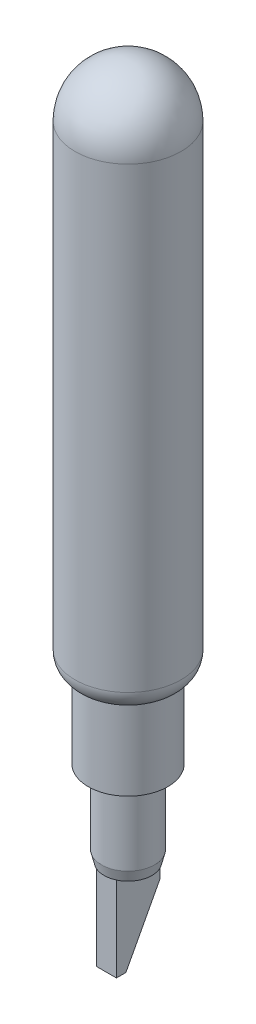
from build123d import *

# Parameters (mm, degrees)
CROQUIS1_R              = 10
SALIENTE_EXTRUIR1_DEPTH = 100
CROQUIS2_R              = 7.5
SALIENTE_EXTRUIR2_DEPTH = 15
CROQUIS3_R              = 5
SALIENTE_EXTRUIR3_DEPTH = 16
REDONDEO1_R             = 4
CHAFL_N1_SIZE           = 1.99
CHAFL_N1_SIZE2          = 0.496162726
CROQUIS4_W              = 3.793672416
CROQUIS4_H              = 8.169837842
SALIENTE_EXTRUIR4_DEPTH = 16
CHAFL_N2_SIZE           = 12
CHAFL_N2_SIZE2          = 6.38051318
REDONDEO2_R             = 10


with BuildPart() as part:
    # Croquis1 → Saliente-Extruir1 (new body)
    with BuildSketch(Plane(origin=(0, 0, 0), x_dir=(1, 0, 0), z_dir=(0, 1, 0))):
        with Locations(Location((0, 0, 0), (0, 0, 270))):
            Circle(CROQUIS1_R)
    extrude(amount=SALIENTE_EXTRUIR1_DEPTH)

    # Croquis2 → Saliente-Extruir2 (add)
    with BuildSketch(Plane.XZ):
        with Locations(Location((0, 0, 0), (0, 0, 270))):
            Circle(CROQUIS2_R)
    extrude(amount=SALIENTE_EXTRUIR2_DEPTH)

    # Croquis3 → Saliente-Extruir3 (add)
    with BuildSketch(Plane.XZ.offset(15)):
        with Locations(Location((0, 0, 0), (0, 0, 270))):
            Circle(CROQUIS3_R)
    extrude(amount=SALIENTE_EXTRUIR3_DEPTH)

    # Redondeo1
    # the kernel refuses this fillet: 4 mm, written as the material it takes off along each edge
    with BuildSketch(Plane(origin=(0, 0, 0), x_dir=(0, 0, 1), z_dir=(-1, 0, 0))) as redondeo1_piece_1:
        with BuildLine():
            CenterArc((6, 3.708099244), REDONDEO1_R, 292.024312837, 67.975687163)
            Line((7.5, 0), (7.53, -0.074161985))
            ThreePointArc((7.53, -0.074161985), (8.75, -0.08), (10, -0.08))
            Line((10, -0.08), (10.08, 0))
            Line((10.08, 0), (10.08, 3.708099244))
            Line((10.08, 3.708099244), (10, 3.708099244))
        make_face()
    revolve(axis=Axis((0, 0, 0), (0, 1, 0)), mode=Mode.SUBTRACT)

    # Chaflán1
    chafl_n1_edges = [part.edges().sort_by_distance(p)[0] for p in [
        (0, -31, 5),
    ]]
    chafl_n1_side = [part.faces().sort_by_distance(p)[0] for p in [
        (0, -23, 5),
    ]]
    chamfer(chafl_n1_edges, length=CHAFL_N1_SIZE, length2=CHAFL_N1_SIZE2, reference=chafl_n1_side[0])

    # Croquis4 → Saliente-Extruir4 (add)
    with BuildSketch(Plane.XZ.offset(31)):
        Rectangle(CROQUIS4_W, CROQUIS4_H)
    extrude(amount=SALIENTE_EXTRUIR4_DEPTH)

    # Chaflán2
    chafl_n2_edges = [part.edges().sort_by_distance(p)[0] for p in [
        (0, -47, -4.084918921),
    ]]
    chafl_n2_side = [part.faces().sort_by_distance(p)[0] for p in [
        (0, -39, -4.084918921),
    ]]
    chamfer(chafl_n2_edges, length=CHAFL_N2_SIZE, length2=CHAFL_N2_SIZE2, reference=chafl_n2_side[0])

    # Redondeo2
    redondeo2_edges = [part.edges().sort_by_distance(p)[0] for p in [
        (0, 100, -10),
    ]]
    fillet(redondeo2_edges, radius=REDONDEO2_R)


solid = part.part
